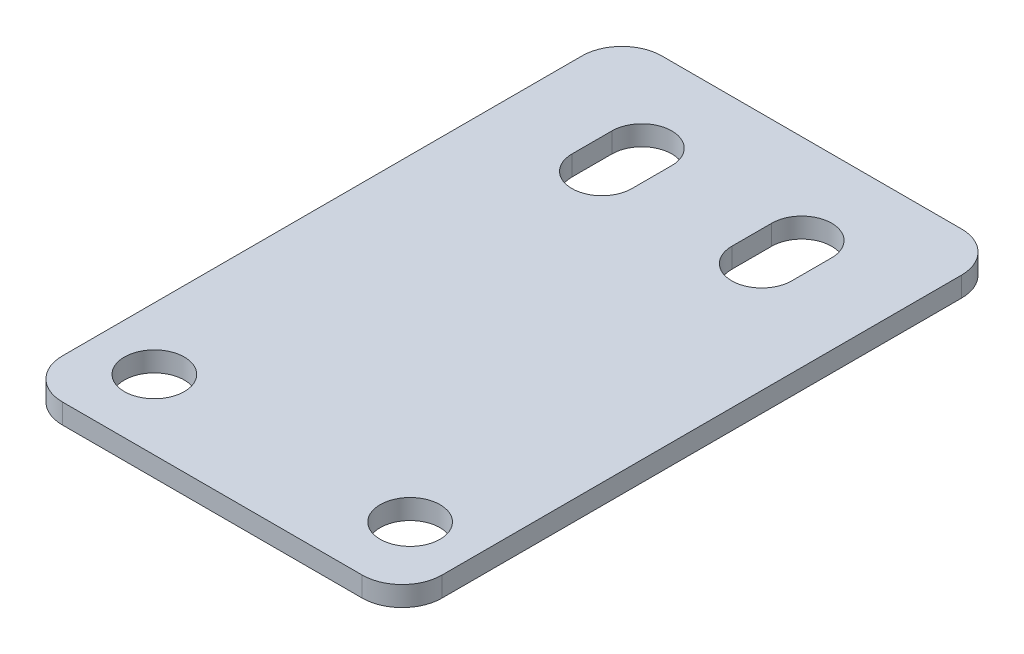
from build123d import *

# Parameters (mm, degrees)
SKETCH_1_W             = 19
SKETCH_1_H             = 30
SKETCH_1_R             = 1.5
SM_BASE_FLANGE_1_DEPTH = 1
FILLET_1_R             = 2


# Sheet-metal steps are written as plain solids
with BuildPart() as part:
    # Sketch 1 → 基体-法兰1 (new body)
    with BuildSketch(Plane(origin=(0, 0, 0), x_dir=(1, 0, 0), z_dir=(0, 1, 0))):
        with Locations((0, 11.5)):
            Rectangle(SKETCH_1_W, SKETCH_1_H)
        with Locations(Location((-6.4, 0, 0), (0, 0, 270))):
            Circle(SKETCH_1_R, mode=Mode.SUBTRACT)
        with Locations(Location((6.4, 0, 0), (0, 0, 270))):
            Circle(SKETCH_1_R, mode=Mode.SUBTRACT)
        with BuildLine():
            Line((-2.5, 22), (-2.5, 20))
            ThreePointArc((-2.5, 20), (-4, 18.5), (-5.5, 20))
            Line((-5.5, 20), (-5.5, 22))
            ThreePointArc((-5.5, 22), (-4, 23.5), (-2.5, 22))
        make_face(mode=Mode.SUBTRACT)
        with BuildLine():
            Line((5.5, 22), (5.5, 20))
            ThreePointArc((5.5, 20), (4, 18.5), (2.5, 20))
            Line((2.5, 20), (2.5, 22))
            ThreePointArc((2.5, 22), (4, 23.5), (5.5, 22))
        make_face(mode=Mode.SUBTRACT)
    extrude(amount=-SM_BASE_FLANGE_1_DEPTH)

    # 圆角1
    fillet_1_edges = [part.edges().sort_by_distance(p)[0] for p in [
        (9.5, -0.5, -26.5),
        (9.5, -0.5, 3.5),
        (-9.5, -0.5, 3.5),
        (-9.5, -0.5, -26.5),
    ]]
    fillet(fillet_1_edges, radius=FILLET_1_R)


solid = part.part
